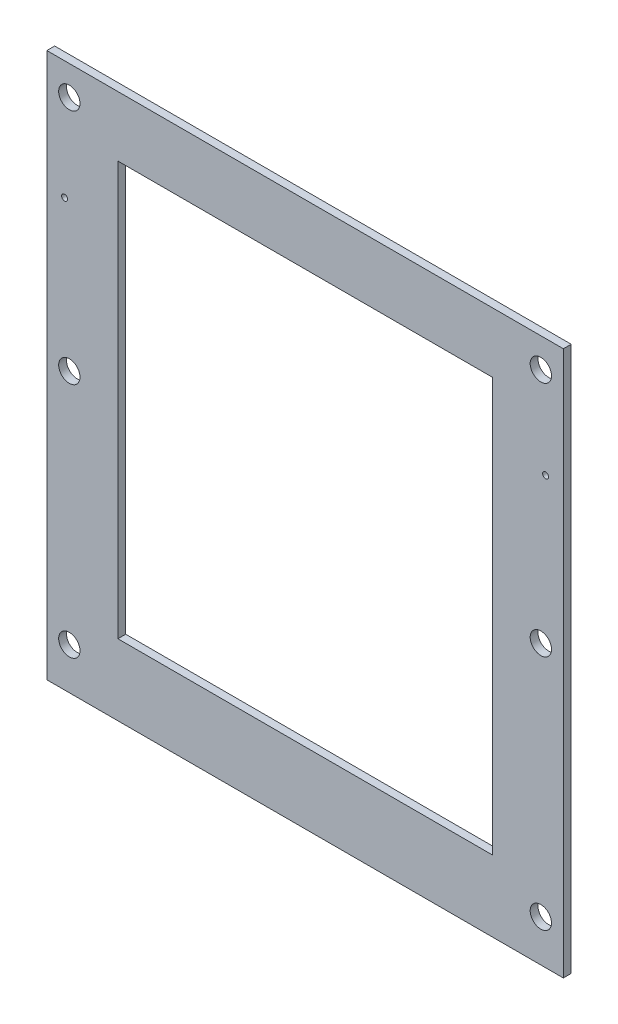
from build123d import *

# Parameters (mm, degrees)
SKETCH1_R           = 4.5
SKETCH1_R_2         = 1.25
SKETCH1_W           = 158
SKETCH1_H           = 174.6
BOSS_EXTRUDE1_DEPTH = 3.302


with BuildPart() as part:
    # Sketch1 → Boss-Extrude1 (new body)
    with BuildSketch(Plane.XY):
        Polygon((81.884816754, 109.882198953), (81.884816754, -120.117801047), (-136.115183246, -120.117801047), (-136.115183246, 109.882198953), (-106.115183246, 109.882198953), (51.884816754, 109.882198953), align=None)
        with Locations((-126.615183246, 97.482198953)):
            Circle(SKETCH1_R, mode=Mode.SUBTRACT)
        with Locations((-126.615183246, -2.517801047)):
            Circle(SKETCH1_R, mode=Mode.SUBTRACT)
        with Locations((-126.615183246, -102.517801047)):
            Circle(SKETCH1_R, mode=Mode.SUBTRACT)
        with Locations((72.384816754, 97.482198953)):
            Circle(SKETCH1_R, mode=Mode.SUBTRACT)
        with Locations((72.384816754, -2.517801047)):
            Circle(SKETCH1_R, mode=Mode.SUBTRACT)
        with Locations((72.384816754, -102.517801047)):
            Circle(SKETCH1_R, mode=Mode.SUBTRACT)
        with Locations((-128.615183246, 59.882198953)):
            Circle(SKETCH1_R_2, mode=Mode.SUBTRACT)
        with Locations((74.384816754, 59.882198953)):
            Circle(SKETCH1_R_2, mode=Mode.SUBTRACT)
        with Locations((-27.115183246, -2.817801047)):
            Rectangle(SKETCH1_W, SKETCH1_H, mode=Mode.SUBTRACT)
    extrude(amount=BOSS_EXTRUDE1_DEPTH)


solid = part.part
